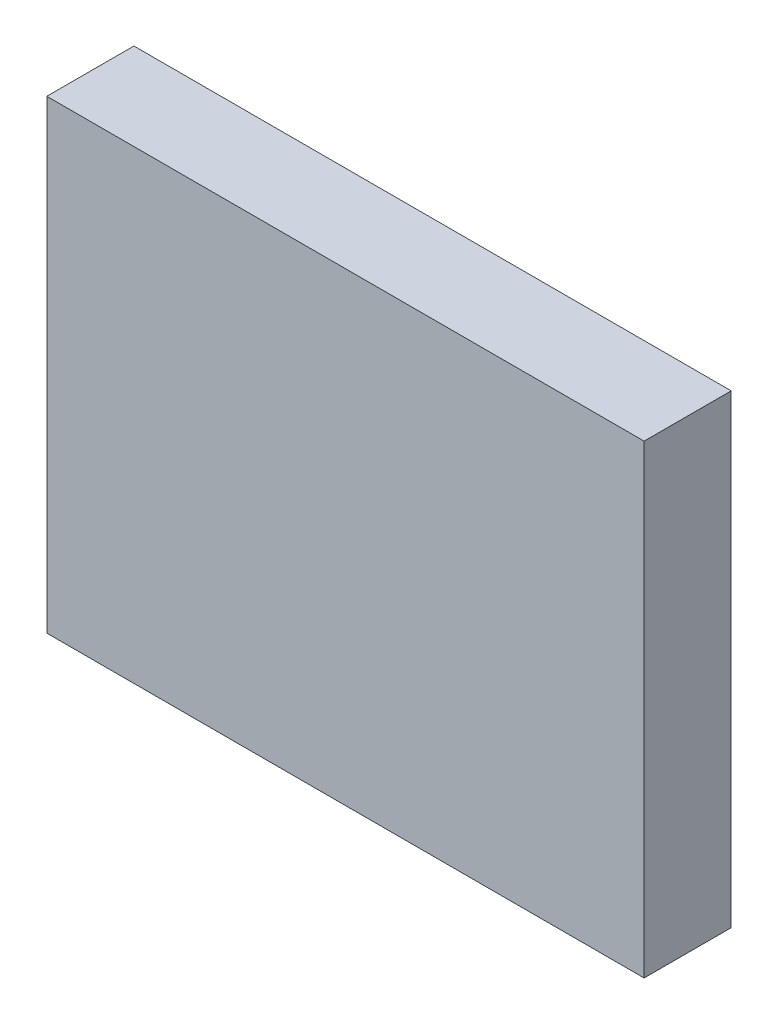
from build123d import *

# Parameters (mm, degrees)
SKETCH1_W           = 68.6
SKETCH1_H           = 53.4
BOSS_EXTRUDE1_DEPTH = 10


with BuildPart() as part:
    # Sketch1 → Boss-Extrude1 (new body)
    with BuildSketch(Plane.XY):
        Rectangle(SKETCH1_W, SKETCH1_H)
    extrude(amount=BOSS_EXTRUDE1_DEPTH)


solid = part.part
